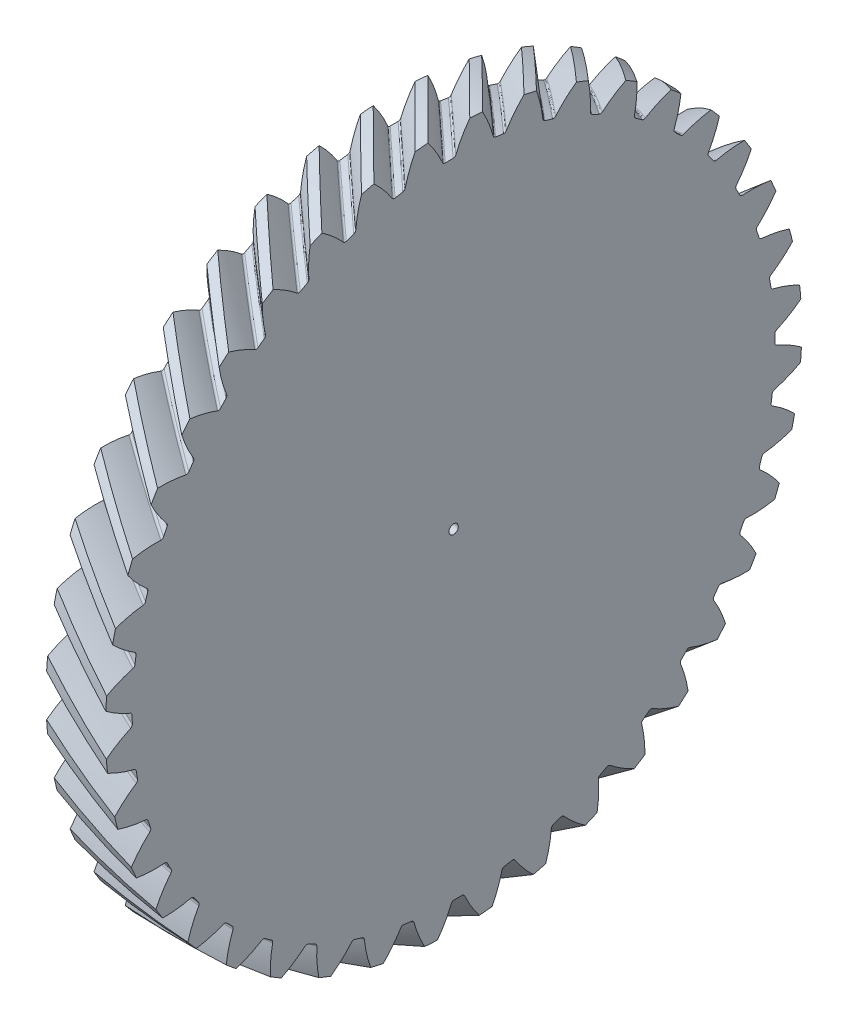
from build123d import *

# Parameters (mm, degrees)
BASPROSKE_W            = 6.35
BASPROSKE_H            = 37.191024484
TOOTHCUTRH_PITCH       = 233.678098599
TOOTHCUTRH_HEIGHT      = 6.35
TOOTHCUTRH_RADIUS      = 37.191024484
TOOTHCUTRH_START_ANGLE = -90
TEETHCUTSRH_COUNT      = 40
TEETHCUTSRH_ANGLE      = 351
BORSKE_R               = 0.499999
BORE_DEPTH             = 50.8000508


with BuildPart() as part:
    # BasProSke → Base-Revolve (revolve)
    with BuildSketch(Plane(origin=(0, 0, 0), x_dir=(1, 0, 0), z_dir=(0, 1, 0)), mode=Mode.PRIVATE) as base_revolve_sk:
        with Locations((3.175, 18.595512242)):
            Rectangle(BASPROSKE_W, BASPROSKE_H)
    revolve(base_revolve_sk.sketch.rotate(Axis((-10, 0, 0), (1, 0, 0)), 180), axis=Axis((-10, 0, 0), (1, 0, 0)))

    # ToothCutRH: sweep along a helix
    with BuildLine() as toothcutrh_path:
        add(Helix(TOOTHCUTRH_PITCH, TOOTHCUTRH_HEIGHT, TOOTHCUTRH_RADIUS, center=(0, 0, 0), direction=(1, 0, 0), mode=Mode.PRIVATE).rotate(Axis((0, 0, 0), (1, 0, 0)), TOOTHCUTRH_START_ANGLE))
    # TooCutSkeRH → ToothCutRH (sweep, cut)
    with BuildSketch(Plane(origin=(0, 0, 0), x_dir=(0, 0, -1), z_dir=(1, 0, 0))):
        with BuildLine():
            ThreePointArc((0.424331355, 34.330902208), (0, 34.333524484), (-0.424331355, 34.330902208))
            ThreePointArc((-0.424331355, 34.330902208), (-0.59365903, 34.379763473), (-0.707636584, 34.514182228))
            ThreePointArc((-0.707636584, 34.514182228), (-1.758436069, 36.451930355), (-3.128471095, 38.178792071))
            ThreePointArc((-3.128471095, 38.178792071), (0, 38.306755219), (3.128471095, 38.178792071))
            ThreePointArc((3.128471095, 38.178792071), (1.758436069, 36.451930355), (0.707636584, 34.514182228))
            ThreePointArc((0.707636584, 34.514182228), (0.59365903, 34.379763473), (0.424331355, 34.330902208))
        make_face()
    toothcutrh = sweep(path=toothcutrh_path.line, is_frenet=True, mode=Mode.SUBTRACT)

    # TeethCutsRH: ToothCutRH ×40 about axis
    teethcutsrh_axis = Axis((-10, 0, 0), (1, 0, 0))
    for i in range(1, TEETHCUTSRH_COUNT):
        add(toothcutrh.rotate(teethcutsrh_axis, i * TEETHCUTSRH_ANGLE / (TEETHCUTSRH_COUNT - 1)), mode=Mode.SUBTRACT)

    # BorSke → Bore (cut, symmetric)
    with BuildSketch(Plane(origin=(0, 0, 0), x_dir=(0, 0, -1), z_dir=(1, 0, 0))):
        with Locations(Location((0, 0, 0), (0, 0, 180))):
            Circle(BORSKE_R)
    extrude(amount=BORE_DEPTH, both=True, mode=Mode.SUBTRACT)


solid = part.part
